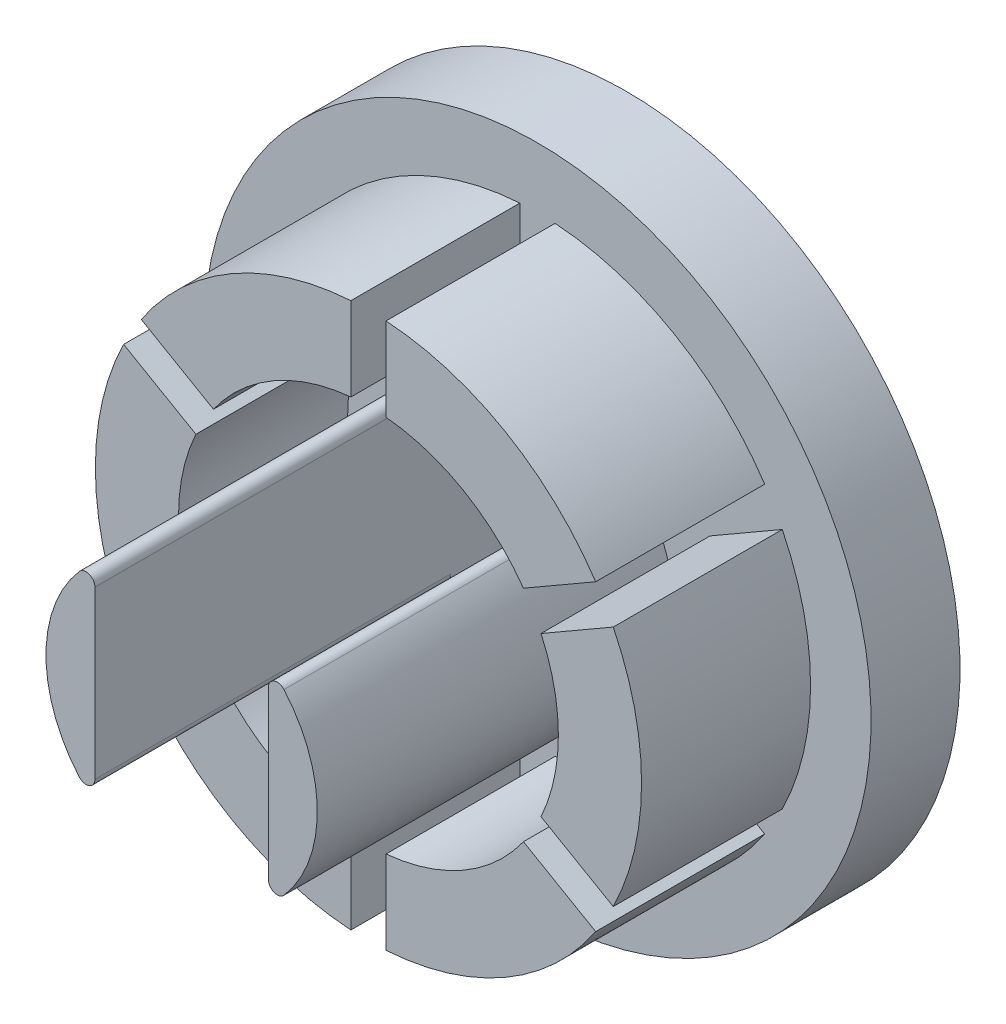
from build123d import *

# Parameters (mm, degrees)
RESSALTO_EXTRUS_O1_DEPTH   = 8
RESSALTO_EXTRUS_O1_2_DEPTH = 8
ESBO_O3_R                  = 7.5
ESBO_O3_R_2                = 1.475
RESSALTO_EXTRUS_O2_DEPTH   = 2
RESSALTO_EXTRUS_O3_DEPTH   = 3.8
CORTE_EXTRUS_O2_DEPTH      = 10


with BuildPart() as part:
    # Esboço2 → Ressalto-extrusão1 (new body)
    with BuildSketch(Plane.XY):
        with BuildLine():
            Line((1.95, -1.870828693), (1.95, 1.870828693))
            ThreePointArc((1.95, 1.870828693), (2.079912336, 2.058145856), (2.300877193, 2.002114917))
            ThreePointArc((2.300877193, 2.002114917), (3.05, 0), (2.300877193, -2.002114917))
            ThreePointArc((2.300877193, -2.002114917), (2.079912336, -2.058145856), (1.95, -1.870828693))
        make_face()
    extrude(amount=RESSALTO_EXTRUS_O1_DEPTH)



with BuildPart() as body_2:
    # Esboço2 → Ressalto-extrus_o1 2 (new body)
    with BuildSketch(Plane.XY):
        with BuildLine():
            Line((-1.95, 1.870828693), (-1.95, -1.870828693))
            ThreePointArc((-1.95, -1.870828693), (-2.079912336, -2.058145856), (-2.300877193, -2.002114917))
            ThreePointArc((-2.300877193, -2.002114917), (-3.05, 0), (-2.300877193, 2.002114917))
            ThreePointArc((-2.300877193, 2.002114917), (-2.079912336, 2.058145856), (-1.95, 1.870828693))
        make_face()
    extrude(amount=RESSALTO_EXTRUS_O1_2_DEPTH)


with BuildPart() as part_1:
    add(part.part)

    add(body_2.part)  # Ressalto-extrusão2 merges body 2
    # Esboço3 → Ressalto-extrusão2 (add)
    with BuildSketch(Plane(origin=(0, 0, 0), x_dir=(-1, 0, 0), z_dir=(0, 0, -1))):
        Circle(ESBO_O3_R)
        Circle(ESBO_O3_R_2, mode=Mode.SUBTRACT)
    extrude(amount=RESSALTO_EXTRUS_O2_DEPTH)

    # Esboço7 → Ressalto-extrusão3 (add)
    with BuildSketch(Plane.XY):
        with BuildLine():
            Line((-5.108881182, 3.405720638), (-3.484572277, 2.467925455))
            ThreePointArc((-3.484572277, 2.467925455), (-2.135, 3.697928474), (-0.395, 4.25169084))
            Line((-0.395, 4.25169084), (-0.395, 6.127281208))
            ThreePointArc((-0.395, 6.127281208), (-3.07, 5.317395979), (-5.108881182, 3.405720638))
        make_face()
        with BuildLine():
            Line((0.395, 6.127281208), (0.395, 4.25169084))
            ThreePointArc((0.395, 4.25169084), (2.135, 3.697928474), (3.484572277, 2.467925455))
            Line((3.484572277, 2.467925455), (5.108881182, 3.405720638))
            ThreePointArc((5.108881182, 3.405720638), (3.07, 5.317395979), (0.395, 6.127281208))
        make_face()
        with BuildLine():
            Line((5.503881182, 2.721560569), (3.879572277, 1.783765386))
            ThreePointArc((3.879572277, 1.783765386), (4.27, 0), (3.879572277, -1.783765386))
            Line((3.879572277, -1.783765386), (5.503881182, -2.721560569))
            ThreePointArc((5.503881182, -2.721560569), (6.14, 0), (5.503881182, 2.721560569))
        make_face()
        with BuildLine():
            Line((5.108881182, -3.405720638), (3.484572277, -2.467925455))
            ThreePointArc((3.484572277, -2.467925455), (2.135, -3.697928474), (0.395, -4.25169084))
            Line((0.395, -4.25169084), (0.395, -6.127281208))
            ThreePointArc((0.395, -6.127281208), (3.07, -5.317395979), (5.108881182, -3.405720638))
        make_face()
        with BuildLine():
            Line((-0.395, -6.127281208), (-0.395, -4.25169084))
            ThreePointArc((-0.395, -4.25169084), (-2.135, -3.697928474), (-3.484572277, -2.467925455))
            Line((-3.484572277, -2.467925455), (-5.108881182, -3.405720638))
            ThreePointArc((-5.108881182, -3.405720638), (-3.07, -5.317395979), (-0.395, -6.127281208))
        make_face()
        with BuildLine():
            Line((-5.503881182, -2.721560569), (-3.879572277, -1.783765386))
            ThreePointArc((-3.879572277, -1.783765386), (-4.27, 0), (-3.879572277, 1.783765386))
            Line((-3.879572277, 1.783765386), (-5.503881182, 2.721560569))
            ThreePointArc((-5.503881182, 2.721560569), (-6.14, 0), (-5.503881182, -2.721560569))
        make_face()
    extrude(amount=RESSALTO_EXTRUS_O3_DEPTH)

    # Esboço10 → Corte-extrusão2 (cut)
    with BuildSketch(Plane.XY):
        with BuildLine():
            Line((1.95, 2.040332159), (1.95, -2.040332159))
            ThreePointArc((1.95, -2.040332159), (0, -2.822313823), (-1.95, -2.040332159))
            Line((-1.95, -2.040332159), (-1.95, 2.040332159))
            ThreePointArc((-1.95, 2.040332159), (0, 2.822313823), (1.95, 2.040332159))
        make_face()
    extrude(amount=-CORTE_EXTRUS_O2_DEPTH, mode=Mode.SUBTRACT)


solid = part_1.part
